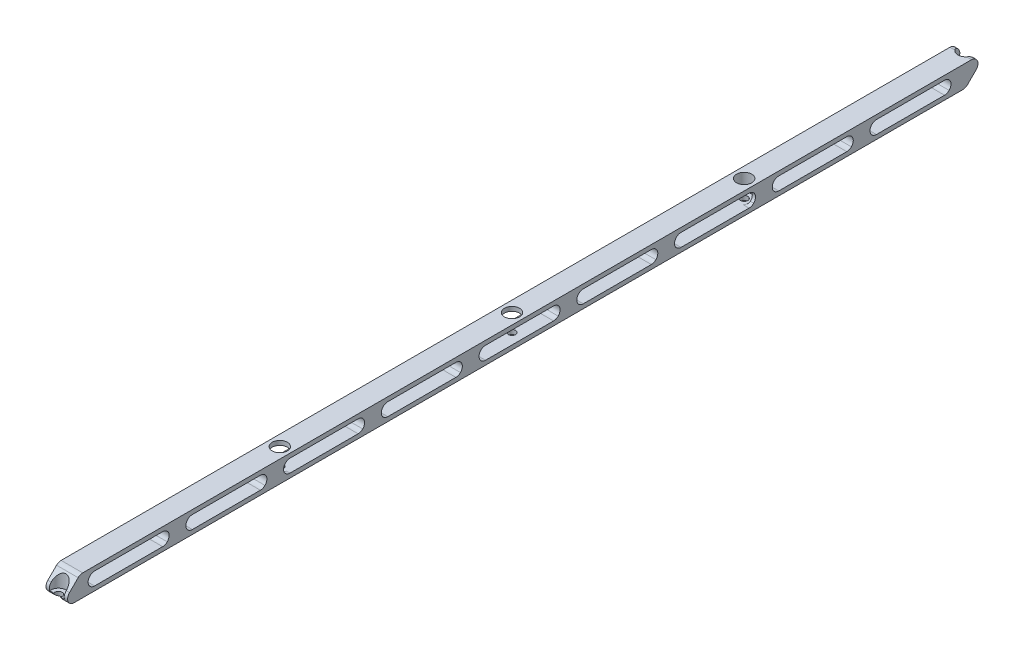
from build123d import *

# Parameters (mm, degrees)
BOSS_EXTRUDE1_DEPTH                          = 10
FILLET1_R                                    = 3
CBORE_FOR_M3_HEX_HEAD_CAP_SCREW1_D           = 3.4
CBORE_FOR_M3_HEX_HEAD_CAP_SCREW1_CBORE_D     = 7
CBORE_FOR_M3_HEX_HEAD_CAP_SCREW1_CBORE_DEPTH = 8


with BuildPart() as part:
    # Sketch1 → Boss-Extrude1 (new body)
    with BuildSketch(Plane(origin=(0, 0, 0), x_dir=(0, 0, -1), z_dir=(1, 0, 0))):
        Polygon((215, 5), (-205, 5), (-215, -5), (205, -5), align=None)
        Polygon((-165.5, -3), (-205.5, -3), (-199.5, 3), (-159.5, 3), align=None, mode=Mode.SUBTRACT)
        Polygon((-160.25, -3), (-154.25, 3), (-114.25, 3), (-120.25, -3), align=None, mode=Mode.SUBTRACT)
        Polygon((-115, -3), (-109, 3), (-69, 3), (-75, -3), align=None, mode=Mode.SUBTRACT)
        Polygon((-69.75, -3), (-63.75, 3), (-23.75, 3), (-29.75, -3), align=None, mode=Mode.SUBTRACT)
        Polygon((-24.5, -3), (-18.5, 3), (21.5, 3), (15.5, -3), align=None, mode=Mode.SUBTRACT)
        Polygon((20.75, -3), (26.75, 3), (66.75, 3), (60.75, -3), align=None, mode=Mode.SUBTRACT)
        Polygon((66, -3), (72, 3), (112, 3), (106, -3), align=None, mode=Mode.SUBTRACT)
        Polygon((111.25, -3), (117.25, 3), (157.25, 3), (151.25, -3), align=None, mode=Mode.SUBTRACT)
        Polygon((156.5, -3), (162.5, 3), (202.5, 3), (196.5, -3), align=None, mode=Mode.SUBTRACT)
    extrude(amount=BOSS_EXTRUDE1_DEPTH)

    # Fillet1
    fillet1_edges = [part.edges().sort_by_distance(p)[0] for p in [
        (5, -5, 215),
        (5, 5, 205),
        (5, -5, -205),
        (5, 5, -215),
        (5, -3, -156.5),
        (5, -3, -151.25),
        (5, 3, -162.5),
        (5, 3, -157.25),
        (5, -3, -106),
        (5, -3, -111.25),
        (5, 3, -112),
        (5, 3, -117.25),
        (5, -3, -66),
        (5, -3, -60.75),
        (5, 3, -72),
        (5, 3, -66.75),
        (5, -3, -15.5),
        (5, -3, -20.75),
        (5, 3, -21.5),
        (5, 3, -26.75),
        (5, -3, 24.5),
        (5, -3, 29.75),
        (5, 3, 18.5),
        (5, 3, 23.75),
        (5, -3, 75),
        (5, -3, 69.75),
        (5, 3, 69),
        (5, 3, 63.75),
        (5, -3, 115),
        (5, -3, 120.25),
        (5, 3, 109),
        (5, 3, 114.25),
        (5, -3, 160.25),
        (5, 3, 159.5),
        (5, 3, 154.25),
        (5, -3, 205.5),
        (5, 3, 199.5),
        (5, -3, -196.5),
        (5, 3, -202.5),
        (5, -3, 165.5),
    ]]
    fillet(fillet1_edges, radius=FILLET1_R - 0.0001)  # a hair under: the kernel refuses the full size

    # CBORE for M3 Hex Head Cap Screw1 (through all)
    with Locations(Plane(origin=(0, 5, 0), x_dir=(1, 0, 0), z_dir=(0, 1, 0))):
        with Locations((5, -210), (5, 0), (5, -107.5), (5, 107.5), (5, 210)):
            CounterBoreHole(CBORE_FOR_M3_HEX_HEAD_CAP_SCREW1_D / 2, CBORE_FOR_M3_HEX_HEAD_CAP_SCREW1_CBORE_D / 2, CBORE_FOR_M3_HEX_HEAD_CAP_SCREW1_CBORE_DEPTH)


solid = part.part
